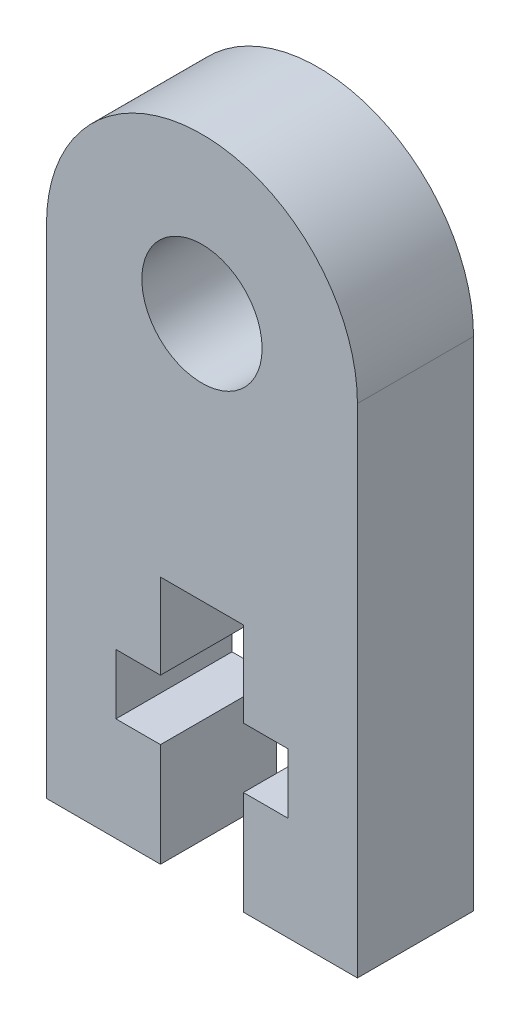
from build123d import *

# Parameters (mm, degrees)
SKETCH1_R           = 2.9
BOSS_EXTRUDE1_DEPTH = 5.6
CUT_EXTRUDE2_DEPTH  = 26.760628874


with BuildPart() as part:
    # Sketch1 → Boss-Extrude1 (new body)
    with BuildSketch(Plane.XY):
        with BuildLine():
            Line((-7.5, 0), (-7.5, -24))
            Line((-7.5, -24), (7.5, -24))
            Line((7.5, -24), (7.5, 0))
            ThreePointArc((7.5, 0), (0, 7.5), (-7.5, 0))
        make_face()
        Circle(SKETCH1_R, mode=Mode.SUBTRACT)
    extrude(amount=BOSS_EXTRUDE1_DEPTH)

    # Sketch3 → Cut-Extrude2 (cut, through all)
    with BuildSketch(Plane.XY.offset(5.6)):
        Polygon((-2, -24), (2, -24), (2, -19), (4.15, -19), (4.15, -16.1), (2, -16.1), (2, -12), (-2, -12), (-2, -16.1), (-4.15, -16.1), (-4.15, -19), (-2, -19), align=None)
    extrude(amount=-CUT_EXTRUDE2_DEPTH, mode=Mode.SUBTRACT)


solid = part.part
